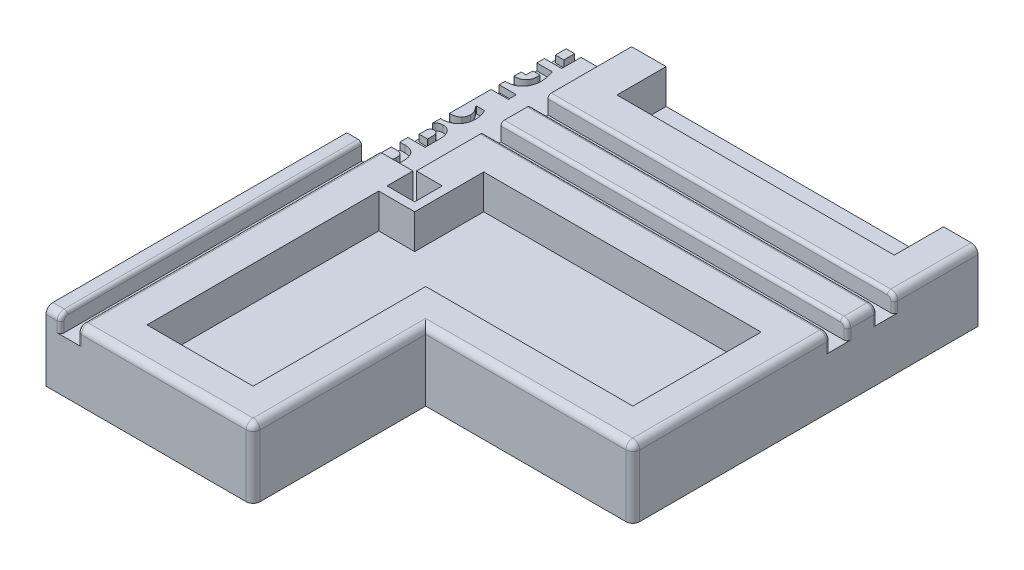
from build123d import *

# Parameters (mm, degrees)
SKETCH1_W                                  = 240
SKETCH1_H                                  = 200
BOSS_EXTRUDE1_DEPTH                        = 20
SKETCH7_W                                  = 120
SKETCH7_H                                  = 50
BOSS_EXTRUDE6_DEPTH                        = 20
FILLET1_R                                  = 2
SKETCH2_W                                  = 39.3
SKETCH2_H                                  = 125.7
CUT_EXTRUDE1_DEPTH                         = 10
CUT_EXTRUDE3_DEPTH                         = 5
MIRROR4_AT_THE_SECOND_PLANE_COPY_1_DEPTH   = 5
SKETCH11_W                                 = 104.748042719
SKETCH11_H                                 = 5
CUT_EXTRUDE4_DEPTH                         = 5
MIRROR6_AT_THE_SECOND_PLANE_COPY_1_SKETC_W = 104.748042719
MIRROR6_AT_THE_SECOND_PLANE_COPY_1_SKETC_H = 5
MIRROR6_AT_THE_SECOND_PLANE_COPY_1_DEPTH   = 5
SHELL1_START                               = 10
SHELL1_OUTLINE_W                           = 80.35
SHELL1_OUTLINE_H                           = 28.5
SHELL1_DEPTH                               = 10
FILLET3_R                                  = 1
SKETCH13_W                                 = 7.252545243
SKETCH13_H                                 = 2.335565418
SKETCH13_W_2                               = 1.720942939
SKETCH13_H_2                               = 2.581414408
CUT_EXTRUDE5_DEPTH                         = 2
CUT_EXTRUDE6_DEPTH                         = 10
MIRROR7_AT_THE_SECOND_PLANE_COPY_1_DEPTH   = 10
SKETCH15_W                                 = 252.845295914
SKETCH15_H                                 = 31.352816693
CUT_EXTRUDE7_DEPTH                         = 194.132079158
SKETCH16_W                                 = 170.828603052
SKETCH16_H                                 = 32.869888469
CUT_EXTRUDE8_DEPTH                         = 194.132079158


# Read off the part's stored shape, not the designer's step: Shell1
with BuildPart() as part:
    # Sketch1 → Boss-Extrude1 (new body)
    with BuildSketch(Plane(origin=(0, 0, 0), x_dir=(1, 0, 0), z_dir=(0, 1, 0))):
        Rectangle(SKETCH1_W, SKETCH1_H)
    extrude(amount=BOSS_EXTRUDE1_DEPTH)

    # Sketch7 → Boss-Extrude6 (add)
    with BuildSketch(Plane(origin=(0, 0, 0), x_dir=(1, 0, 0), z_dir=(0, 1, 0))):
        with Locations((0, 125)):
            Rectangle(SKETCH7_W, SKETCH7_H)
        with Locations((0, -125)):
            Rectangle(SKETCH7_W, SKETCH7_H)
    extrude(amount=BOSS_EXTRUDE6_DEPTH)

    # Fillet1
    fillet1_edges = [part.edges().sort_by_distance(p)[0] for p in [
        (-120, 20, 0),
        (90, 20, 100),
        (-90, 20, 100),
        (-60, 10, 150),
        (60, 10, 150),
        (-60, 20, 125),
        (0, 20, 150),
        (60, 20, 125),
        (-90, 20, -100),
        (60, 20, -125),
        (0, 20, -150),
        (60, 10, -150),
        (-60, 10, -150),
        (-60, 20, -125),
        (120, 20, 0),
        (120, 10, 100),
        (-120, 10, 100),
        (-120, 10, -100),
        (120, 10, -100),
        (90, 20, -100),
    ]]
    fillet(fillet1_edges, radius=FILLET1_R)

    # Sketch2 → Cut-Extrude1 (cut)
    with BuildSketch(Plane(origin=(0, 20, 0), x_dir=(1, 0, 0), z_dir=(0, 1, 0))):
        Rectangle(SKETCH2_W, SKETCH2_H)
    extrude(amount=-CUT_EXTRUDE1_DEPTH, mode=Mode.SUBTRACT)

    # Sketch10 → Cut-Extrude3 (cut)
    with BuildSketch(Plane(origin=(0, 20, 0), x_dir=(1, 0, 0), z_dir=(0, 1, 0))):
        Polygon((-9.25, -40.5), (-9.25, -33.162899401), (-4.25, -33.162899401), (-4.25, -40.5), (-4.25, -156.832928994), (-9.25, -156.832928994), align=None)
    cut_extrude3 = extrude(amount=-CUT_EXTRUDE3_DEPTH, mode=Mode.SUBTRACT)

    # Mirror4: Cut-Extrude3 across plane
    add(cut_extrude3.mirror(Plane(origin=(0, 0, 0), x_dir=(0, 0, 1), z_dir=(1, 0, 0))), mode=Mode.SUBTRACT)

    # Mirror4 at the second plane: Cut-Extrude3 across plane
    add(cut_extrude3.mirror(Plane.XY), mode=Mode.SUBTRACT)

    # Mirror4 at the second plane copy 1 sketc → Mirror4 at the second plane copy 1 (cut)
    with BuildSketch(Plane(origin=(0, 20, 0), x_dir=(-1, 0, 0), z_dir=(0, 1, 0))):
        Polygon((-9.25, -40.5), (-9.25, -33.162899401), (-4.25, -33.162899401), (-4.25, -40.5), (-4.25, -156.832928994), (-9.25, -156.832928994), align=None)
    extrude(amount=-MIRROR4_AT_THE_SECOND_PLANE_COPY_1_DEPTH, mode=Mode.SUBTRACT)

    # Sketch11 → Cut-Extrude4 (cut)
    with BuildSketch(Plane(origin=(0, 20, 0), x_dir=(1, 0, 0), z_dir=(0, 1, 0))):
        with Locations((-72.024021359, 26.75)):
            Rectangle(SKETCH11_W, SKETCH11_H)
        with Locations((-72.024021359, 40.35)):
            Rectangle(SKETCH11_W, SKETCH11_H)
    cut_extrude4 = extrude(amount=-CUT_EXTRUDE4_DEPTH, mode=Mode.SUBTRACT)

    # Mirror6: Cut-Extrude4 across plane
    add(cut_extrude4.mirror(Plane.XY), mode=Mode.SUBTRACT)

    # Mirror6 at the second plane: Cut-Extrude4 across plane
    add(cut_extrude4.mirror(Plane(origin=(0, 0, 0), x_dir=(0, 0, 1), z_dir=(1, 0, 0))), mode=Mode.SUBTRACT)

    # Mirror6 at the second plane copy 1 sketc → Mirror6 at the second plane copy 1 (cut)
    with BuildSketch(Plane(origin=(0, 20, 0), x_dir=(-1, 0, 0), z_dir=(0, 1, 0))):
        with Locations((-72.024021359, 26.75)):
            Rectangle(MIRROR6_AT_THE_SECOND_PLANE_COPY_1_SKETC_W, MIRROR6_AT_THE_SECOND_PLANE_COPY_1_SKETC_H)
        with Locations((-72.024021359, 40.35)):
            Rectangle(MIRROR6_AT_THE_SECOND_PLANE_COPY_1_SKETC_W, MIRROR6_AT_THE_SECOND_PLANE_COPY_1_SKETC_H)
    extrude(amount=-MIRROR6_AT_THE_SECOND_PLANE_COPY_1_DEPTH, mode=Mode.SUBTRACT)

    # Shell1 outline → Shell1 (cut)
    with BuildSketch(Plane(origin=(0, 0, 0), x_dir=(1, 0, 0), z_dir=(0, 1, 0)).offset(SHELL1_START)):
        Polygon((-29.65, 72.85), (-19.25, 72.85), (-19.25, 140), (-50, 140), (-50, 90), (-110, 90), (-110, 52.85), (-29.65, 52.85), align=None)
        Polygon((19.25, 72.85), (29.65, 72.85), (29.65, 52.85), (110, 52.85), (110, 90), (50, 90), (50, 140), (19.25, 140), align=None)
        Polygon((-110, -52.85), (-110, -90), (-50, -90), (-50, -140), (-19.25, -140), (-19.25, -72.85), (-29.65, -72.85), (-29.65, -52.85), align=None)
        with Locations((-69.825, 0)):
            Rectangle(SHELL1_OUTLINE_W, SHELL1_OUTLINE_H)
        Polygon((29.65, -72.85), (19.25, -72.85), (19.25, -140), (50, -140), (50, -90), (110, -90), (110, -52.85), (29.65, -52.85), align=None)
        with Locations((69.825, 0)):
            Rectangle(SHELL1_OUTLINE_W, SHELL1_OUTLINE_H)
    extrude(amount=SHELL1_DEPTH, mode=Mode.SUBTRACT)

    # Fillet3
    fillet3_edges = [part.edges().sort_by_distance(p)[0] for p in [
        (-4.25, 16.5, 150),
        (-4.25, 19.414213562, 149.414213562),
        (-9.25, 16.5, 150),
        (-9.25, 19.414213562, 149.414213562),
        (-4.25, 20, 105.425),
        (-9.25, 20, 105.425),
        (-9.25, 19.414213562, -149.414213562),
        (-9.25, 16.5, -150),
        (-9.25, 20, -105.425),
        (-4.25, 16.5, -150),
        (-4.25, 19.414213562, -149.414213562),
        (-4.25, 20, -105.425),
        (9.25, 16.5, 150),
        (9.25, 20, 105.425),
        (9.25, 19.414213562, 149.414213562),
        (4.25, 16.5, 150),
        (4.25, 19.414213562, 149.414213562),
        (4.25, 20, 105.425),
        (4.25, 16.5, -150),
        (4.25, 19.414213562, -149.414213562),
        (9.25, 19.414213562, -149.414213562),
        (9.25, 16.5, -150),
        (4.25, 20, -105.425),
        (9.25, 20, -105.425),
        (-120, 16.5, -24.25),
        (-120, 16.5, -29.25),
        (-119.414213562, 19.414213562, -24.25),
        (-119.414213562, 19.414213562, -29.25),
        (-68.825, 20, -24.25),
        (-68.825, 20, -29.25),
        (-120, 16.5, -37.85),
        (-120, 16.5, -42.85),
        (-68.825, 20, -37.85),
        (-68.825, 20, -42.85),
        (-119.414213562, 19.414213562, -37.85),
        (-119.414213562, 19.414213562, -42.85),
        (68.825, 20, -29.25),
        (119.414213562, 19.414213562, -29.25),
        (119.414213562, 19.414213562, -24.25),
        (68.825, 20, -24.25),
        (120, 16.5, -29.25),
        (120, 16.5, -24.25),
        (68.825, 20, -42.85),
        (119.414213562, 19.414213562, -42.85),
        (119.414213562, 19.414213562, -37.85),
        (68.825, 20, -37.85),
        (120, 16.5, -42.85),
        (120, 16.5, -37.85),
        (-120, 16.5, 29.25),
        (-120, 16.5, 24.25),
        (-68.825, 20, 29.25),
        (-119.414213562, 19.414213562, 29.25),
        (-119.414213562, 19.414213562, 24.25),
        (-68.825, 20, 24.25),
        (-120, 16.5, 42.85),
        (-120, 16.5, 37.85),
        (-68.825, 20, 42.85),
        (-119.414213562, 19.414213562, 42.85),
        (-119.414213562, 19.414213562, 37.85),
        (-68.825, 20, 37.85),
        (120, 16.5, 24.25),
        (120, 16.5, 29.25),
        (119.414213562, 19.414213562, 24.25),
        (119.414213562, 19.414213562, 29.25),
        (68.825, 20, 24.25),
        (68.825, 20, 29.25),
        (120, 16.5, 37.85),
        (120, 16.5, 42.85),
        (68.825, 20, 37.85),
        (68.825, 20, 42.85),
        (119.414213562, 19.414213562, 37.85),
        (119.414213562, 19.414213562, 42.85),
    ]]
    fillet(fillet3_edges, radius=FILLET3_R)

    # Sketch13 → Cut-Extrude5 (cut)
    # profile 1 of 12: a face of its own
    with BuildSketch(Plane(origin=(0, 10, 0), x_dir=(1, 0, 0), z_dir=(0, 1, 0))):
        Polygon((2.787359078, 56.729654742), (2.787359078, 55.37748529), (5, 55.37748529), (5, 53.041919872), (2.787359078, 53.041919872), (2.787359078, 48.247864542), (0.880108701, 48.247864542), (-4.711035156, 52.886343558), (-4.711035156, 55.37748529), (0.943491644, 55.37748529), (0.943491644, 56.729654742), align=None)
        Polygon((0.943491644, 53.041919872), (-2.596349692, 53.041919872), (0.943491644, 50.110938929), align=None, mode=Mode.SUBTRACT)
    # profile 2 of 12: a face of its own
    with BuildSketch(Plane(origin=(0, 10, 0), x_dir=(1, 0, 0), z_dir=(0, 1, 0))):
        with BuildLine():
            Line((5, 47.141544081), (5, 39.520225351))
            Line((5, 39.520225351), (3.409664338, 39.520225351))
            add(Edge.make_bspline(
                [(3.409664338, 39.520225351), (3.190599668, 39.81675512), (2.747057383, 40.417141716), (2.167094132, 41.14339637), (1.704390868, 41.703253096), (1.381972101, 42.083056551), (1.083256561, 42.417759603), (0.887687077, 42.622007507), (0.79559811, 42.718182933)],
                knots=[0, 0, 0, 0, 1.605452287, 3.25057426, 4.046675402, 4.768563423, 5.420146126, 6, 6, 6, 6], degree=3))
            add(Edge.make_bspline(
                [(0.79559811, 42.718182933), (0.732570292, 42.782561984), (0.609352585, 42.908421315), (0.423765416, 43.085974145), (0.244476812, 43.249198615), (0.074088064, 43.400664381), (-0.092796487, 43.534082219), (-0.252790737, 43.654099684), (-0.406497488, 43.759962438), (-0.599845109, 43.881290453), (-0.837875375, 44.00401532), (-1.125540586, 44.112139625), (-1.412736444, 44.178491494), (-1.604945873, 44.187117789), (-1.699385013, 44.191356186)],
                knots=[0, 0, 0, 0, 1.090093853, 2.131104457, 3.107135244, 4.023908394, 4.888948297, 5.691514549, 6.4435893, 7.146498757, 8.452673016, 9.675803408, 10.85804184, 12, 12, 12, 12], degree=3))
            add(Edge.make_bspline(
                [(-1.699385013, 44.191356186), (-1.754483363, 44.189605987), (-1.861179083, 44.186216799), (-2.017224671, 44.167846758), (-2.162681909, 44.132103765), (-2.300488192, 44.087839319), (-2.42643972, 44.024206924), (-2.544199113, 43.950411254), (-2.650531499, 43.859818439), (-2.749307162, 43.758726543), (-2.834556733, 43.642742478), (-2.911599654, 43.517157005), (-2.971430142, 43.377241787), (-3.024398474, 43.226819474), (-3.063653395, 43.063897589), (-3.092633036, 42.889340485), (-3.109905835, 42.703165878), (-3.111960528, 42.574807759), (-3.113016713, 42.508827152)],
                knots=[0, 0, 0, 0, 1.058578686, 2.049894692, 3.010224385, 3.931750511, 4.822578239, 5.71281177, 6.594427321, 7.498813824, 8.420995957, 9.353043897, 10.321837571, 11.3367408, 12.413304787, 13.535187771, 14.732999458, 16, 16, 16, 16], degree=3))
            add(Edge.make_bspline(
                [(-3.113016713, 42.508827152), (-3.110052719, 42.405568465), (-3.104041103, 42.196137688), (-3.053985994, 41.878413923), (-2.980602684, 41.552282773), (-2.873221808, 41.222921491), (-2.74714341, 40.895094854), (-2.596251992, 40.578640505), (-2.438170844, 40.269132893), (-2.314289691, 40.074405983), (-2.252545243, 39.977350819)],
                knots=[0, 0, 0, 0, 0.914703558, 1.855215137, 2.844920106, 3.875005138, 4.922433174, 5.955639304, 6.981056277, 8, 8, 8, 8], degree=3))
            Line((-2.252545243, 39.977350819), (-2.252545243, 39.766074342))
            Line((-2.252545243, 39.766074342), (-4.363389317, 39.766074342))
            add(Edge.make_bspline(
                [(-4.363389317, 39.766074342), (-4.396975153, 39.85152697), (-4.470639347, 40.038951181), (-4.568658946, 40.352153969), (-4.66491051, 40.720660415), (-4.763825821, 41.132864511), (-4.849735205, 41.573321973), (-4.910075419, 42.024211578), (-4.95119256, 42.474770211), (-4.954991729, 42.775713815), (-4.956884148, 42.92561802)],
                knots=[0, 0, 0, 0, 0.681686624, 1.495150967, 2.435076171, 3.509887788, 4.642826517, 5.765734475, 6.887081194, 8, 8, 8, 8], degree=3))
            add(Edge.make_bspline(
                [(-4.956884148, 42.92561802), (-4.954912362, 43.072306092), (-4.951074185, 43.357841566), (-4.914531776, 43.772464491), (-4.853049644, 44.160650299), (-4.769612134, 44.521836328), (-4.662431161, 44.856562797), (-4.529987596, 45.163893905), (-4.371768891, 45.443672956), (-4.191325, 45.69718541), (-3.986517109, 45.920499957), (-3.762299213, 46.116633841), (-3.516918106, 46.283180062), (-3.250583577, 46.417510178), (-2.964907945, 46.521931142), (-2.659732708, 46.596780352), (-2.333869778, 46.641015432), (-2.109911454, 46.646854566), (-1.995172081, 46.649846099)],
                knots=[0, 0, 0, 0, 1.302669921, 2.535710425, 3.693104205, 4.791067539, 5.825099944, 6.810730835, 7.758000335, 8.67487823, 9.568447078, 10.443087854, 11.315285082, 12.19521531, 13.085757283, 14.011200708, 14.981089066, 16, 16, 16, 16], degree=3))
            add(Edge.make_bspline(
                [(-1.995172081, 46.649846099), (-1.918295051, 46.648245135), (-1.764899121, 46.645050664), (-1.536586701, 46.623146341), (-1.311198259, 46.589276583), (-1.089189633, 46.538876948), (-0.870129482, 46.472993238), (-0.653296175, 46.39436831), (-0.439122967, 46.302496277), (-0.229338943, 46.193054838), (-0.018163961, 46.072147599), (0.191952814, 45.932794317), (0.405837655, 45.781094454), (0.620958688, 45.614342324), (0.835471411, 45.430057751), (1.055741697, 45.23549192), (1.273520634, 45.021368665), (1.417594688, 44.872241147), (1.490889788, 44.796375188)],
                knots=[0, 0, 0, 0, 0.907170522, 1.810115022, 2.704515666, 3.595334857, 4.494160497, 5.402400165, 6.316123003, 7.242010315, 8.19323076, 9.186549597, 10.215937183, 11.28746875, 12.397107329, 13.552885457, 14.755074217, 16, 16, 16, 16], degree=3))
            add(Edge.make_bspline(
                [(1.490889788, 44.796375188), (1.669671754, 44.600991906), (2.021428479, 44.216571794), (2.422503942, 43.720261203), (2.710127438, 43.347225494), (2.892573427, 43.11547907), (3.035611297, 42.923413887), (3.11966375, 42.809753418), (3.156132565, 42.760438229)],
                knots=[0, 0, 0, 0, 1.811045763, 3.563265038, 4.362127914, 5.033096026, 5.580478129, 6, 6, 6, 6], degree=3))
            Line((3.156132565, 42.760438229), (3.156132565, 47.141544081))
            Line((3.156132565, 47.141544081), (5, 47.141544081))
        make_face()
    # profile 3 of 12: a face of its own
    with BuildSketch(Plane(origin=(0, 10, 0), x_dir=(1, 0, 0), z_dir=(0, 1, 0))):
        with BuildLine():
            add(Edge.make_bspline(
                [(0.138720336, 37.553433421), (0.339837036, 37.551198694), (0.731017162, 37.546852061), (1.301575539, 37.503210957), (1.839727263, 37.435290008), (2.344336806, 37.340402007), (2.812295891, 37.218717557), (3.235819492, 37.059739443), (3.620265586, 36.877229499), (3.845547684, 36.720963882), (3.955141787, 36.64494457)],
                knots=[0, 0, 0, 0, 1.210994604, 2.355433537, 3.443919748, 4.476135166, 5.446013627, 6.351277171, 7.197937607, 8, 8, 8, 8], degree=3))
            add(Edge.make_bspline(
                [(3.955141787, 36.64494457), (4.057367971, 36.5617232), (4.260610648, 36.396265258), (4.524020765, 36.101981434), (4.745368417, 35.772676286), (4.897303004, 35.472877401), (4.999247268, 35.217133399), (5.063592063, 35.011802969), (5.122267484, 34.796985151), (5.167723638, 34.570405454), (5.201934481, 34.333084121), (5.226664862, 34.085073274), (5.242295446, 33.825562266), (5.244648027, 33.648682389), (5.245848991, 33.558387312)],
                knots=[0, 0, 0, 0, 1.363120718, 2.710110989, 4.070537742, 5.460816644, 6.180869889, 6.918733188, 7.687278466, 8.485437086, 9.309407483, 10.168795045, 11.065191617, 12, 12, 12, 12], degree=3))
            add(Edge.make_bspline(
                [(5.245848991, 33.558387312), (5.241905689, 33.384062955), (5.234297073, 33.047703496), (5.173081199, 32.562988904), (5.069699732, 32.118069919), (4.926806373, 31.711596248), (4.739854178, 31.34454147), (4.516760058, 31.013155063), (4.251279595, 30.717979546), (4.045332533, 30.554230832), (3.94169692, 30.471830054)],
                knots=[0, 0, 0, 0, 1.200851745, 2.317047666, 3.359233085, 4.342911255, 5.278031965, 6.189548012, 7.088953741, 8, 8, 8, 8], degree=3))
            add(Edge.make_bspline(
                [(3.94169692, 30.471830054), (3.829424185, 30.3947628), (3.600170882, 30.2373967), (3.214838014, 30.049115343), (2.792701976, 29.89168932), (2.331256748, 29.768085058), (1.834031119, 29.675388633), (1.301418942, 29.61187027), (0.734794995, 29.570336966), (0.344952566, 29.565716964), (0.144482422, 29.563341204)],
                knots=[0, 0, 0, 0, 0.822750793, 1.680001256, 2.58557045, 3.544707477, 4.565467581, 5.642347189, 6.787615291, 8, 8, 8, 8], degree=3))
            add(Edge.make_bspline(
                [(0.144482422, 29.563341204), (-0.061754837, 29.565532126), (-0.459970452, 29.569762495), (-1.036345286, 29.613069323), (-1.570746564, 29.680774054), (-2.065452333, 29.775711056), (-2.521358164, 29.900947264), (-2.938473361, 30.06222162), (-3.323134476, 30.249194002), (-3.55325365, 30.406272972), (-3.666176943, 30.483354226)],
                knots=[0, 0, 0, 0, 1.242237956, 2.39858964, 3.479780431, 4.485821505, 5.430991799, 6.32348679, 7.177307181, 8, 8, 8, 8], degree=3))
            add(Edge.make_bspline(
                [(-3.666176943, 30.483354226), (-3.769193286, 30.566416838), (-3.974708441, 30.732124775), (-4.238285133, 31.029639616), (-4.461065672, 31.362253167), (-4.645070962, 31.729678272), (-4.784115122, 32.135791847), (-4.885860052, 32.577168574), (-4.944671996, 33.056148657), (-4.952723667, 33.387282789), (-4.956884148, 33.558387312)],
                knots=[0, 0, 0, 0, 0.915406887, 1.826214983, 2.74012738, 3.682217607, 4.664024873, 5.706462388, 6.814877053, 8, 8, 8, 8], degree=3))
            add(Edge.make_bspline(
                [(-4.956884148, 33.558387312), (-4.955682618, 33.64868302), (-4.953320425, 33.826203271), (-4.937576888, 34.086978277), (-4.913381513, 34.337057391), (-4.877300412, 34.575699285), (-4.828262853, 34.80214551), (-4.773499009, 35.018778584), (-4.706561244, 35.224310597), (-4.601886899, 35.480626422), (-4.447267393, 35.781827029), (-4.217150947, 36.109134402), (-3.948246131, 36.405401156), (-3.739143401, 36.569659884), (-3.633525124, 36.652627351)],
                knots=[0, 0, 0, 0, 0.927772364, 1.823989051, 2.683453821, 3.508702832, 4.302191287, 5.063276402, 5.803871599, 6.520953588, 7.906777029, 9.27188215, 10.622021304, 12, 12, 12, 12], degree=3))
            add(Edge.make_bspline(
                [(-3.633525124, 36.652627351), (-3.521300204, 36.729189524), (-3.292789343, 36.885084383), (-2.908970475, 37.068290297), (-2.492360426, 37.225455121), (-2.036263275, 37.346342452), (-1.54437137, 37.439204828), (-1.015826808, 37.505677425), (-0.450933502, 37.546286922), (-0.061742996, 37.551003841), (0.138720336, 37.553433421)],
                knots=[0, 0, 0, 0, 0.826423845, 1.682753026, 2.582377666, 3.535958882, 4.552416628, 5.629628825, 6.779074777, 8, 8, 8, 8], degree=3))
        make_face()
        with BuildLine():
            add(Edge.make_bspline(
                [(0.138720336, 35.094943508), (-0.002794049, 35.093990238), (-0.275052116, 35.092156251), (-0.667644343, 35.074004214), (-1.028464631, 35.048543297), (-1.357952356, 35.010483072), (-1.656192237, 34.961169576), (-1.923473104, 34.900935006), (-2.158488294, 34.828227196), (-2.363936988, 34.745989678), (-2.54162794, 34.64913888), (-2.69467252, 34.537908006), (-2.823572221, 34.410664927), (-2.931286275, 34.270097317), (-3.011274034, 34.111739825), (-3.072443859, 33.941187009), (-3.106785969, 33.754382189), (-3.110895684, 33.625106618), (-3.113016713, 33.558387312)],
                knots=[0, 0, 0, 0, 1.684598718, 3.240982106, 4.677870026, 5.990101975, 7.188004416, 8.275163324, 9.249099904, 10.113910365, 10.905306099, 11.652292794, 12.358339015, 13.054983843, 13.750418457, 14.461547751, 15.206002611, 16, 16, 16, 16], degree=3))
            add(Edge.make_bspline(
                [(-3.113016713, 33.558387312), (-3.110895681, 33.491668012), (-3.106785962, 33.362392453), (-3.072443884, 33.175587552), (-3.011273943, 33.005035023), (-2.931286606, 32.84667649), (-2.823570979, 32.706112772), (-2.694677343, 32.578854684), (-2.541608299, 32.467684345), (-2.363496496, 32.37029911), (-2.157013742, 32.289020864), (-1.921590867, 32.215742751), (-1.654258135, 32.155647372), (-1.355414385, 32.106122047), (-1.024612933, 32.068276855), (-0.661244964, 32.04269777), (-0.266085327, 32.024665897), (0.008090715, 32.022799039), (0.150244508, 32.021831116)],
                knots=[0, 0, 0, 0, 0.791766581, 1.534129826, 2.243261137, 2.936741863, 3.631429404, 4.335491923, 5.08037989, 5.869552125, 6.738971147, 7.710171362, 8.794275798, 9.988812621, 11.304907075, 12.745337551, 14.312534512, 16, 16, 16, 16], degree=3))
            add(Edge.make_bspline(
                [(0.150244508, 32.021831116), (0.289201434, 32.022765136), (0.556986265, 32.024565091), (0.943773412, 32.043063349), (1.30096878, 32.067483158), (1.627502144, 32.109075315), (1.924420257, 32.156514098), (2.190195476, 32.220950105), (2.427221865, 32.292197549), (2.635687527, 32.376524358), (2.816464841, 32.475577579), (2.974492505, 32.586386469), (3.106149375, 32.714997304), (3.215613674, 32.855867424), (3.298888327, 33.012083539), (3.358752163, 33.181622444), (3.396338685, 33.365314373), (3.400067537, 33.492898418), (3.401981557, 33.558387312)],
                knots=[0, 0, 0, 0, 1.658832269, 3.196746878, 4.622488866, 5.931787449, 7.125569234, 8.210133994, 9.194149195, 10.078471196, 10.889203548, 11.650697572, 12.375032472, 13.07829054, 13.77251817, 14.478471121, 15.218999177, 16, 16, 16, 16], degree=3))
            add(Edge.make_bspline(
                [(3.401981557, 33.558387312), (3.400068186, 33.623876875), (3.3963406, 33.751462223), (3.358745104, 33.935144911), (3.298913291, 34.10471679), (3.215521541, 34.260812329), (3.106775331, 34.40178813), (2.97377315, 34.528364287), (2.816557237, 34.639341559), (2.635707586, 34.738476019), (2.42683161, 34.821967534), (2.190341985, 34.897522561), (1.921851262, 34.956560743), (1.624132619, 35.009519497), (1.295502071, 35.045529443), (0.936895825, 35.074962985), (0.547988509, 35.091838226), (0.278306115, 35.093884415), (0.138720336, 35.094943508)],
                knots=[0, 0, 0, 0, 0.778971247, 1.517574904, 2.221693305, 2.914116855, 3.615547377, 4.332711038, 5.092226179, 5.900851692, 6.782875619, 7.766611013, 8.854037796, 10.053520173, 11.366075456, 12.788704916, 14.337855446, 16, 16, 16, 16], degree=3))
        make_face(mode=Mode.SUBTRACT)
    # profile 4 of 12: a face of its own
    with BuildSketch(Plane(origin=(0, 10, 0), x_dir=(1, 0, 0), z_dir=(0, 1, 0))):
        with BuildLine():
            Line((5, 28.211171751), (5, 20.589853021))
            Line((5, 20.589853021), (3.409664338, 20.589853021))
            add(Edge.make_bspline(
                [(3.409664338, 20.589853021), (3.190599668, 20.88638279), (2.747057383, 21.486769386), (2.167094132, 22.21302404), (1.704390868, 22.772880767), (1.381972101, 23.152684221), (1.083256561, 23.487387273), (0.887687077, 23.691635177), (0.79559811, 23.787810603)],
                knots=[0, 0, 0, 0, 1.605452287, 3.25057426, 4.046675402, 4.768563423, 5.420146126, 6, 6, 6, 6], degree=3))
            add(Edge.make_bspline(
                [(0.79559811, 23.787810603), (0.732570292, 23.852189654), (0.609352585, 23.978048985), (0.423765416, 24.155601815), (0.244476812, 24.318826285), (0.074088064, 24.470292051), (-0.092796487, 24.60370989), (-0.252790737, 24.723727355), (-0.406497488, 24.829590108), (-0.599845109, 24.950918123), (-0.837875375, 25.07364299), (-1.125540586, 25.181767295), (-1.412736444, 25.248119164), (-1.604945873, 25.256745459), (-1.699385013, 25.260983856)],
                knots=[0, 0, 0, 0, 1.090093853, 2.131104457, 3.107135244, 4.023908394, 4.888948297, 5.691514549, 6.4435893, 7.146498757, 8.452673016, 9.675803408, 10.85804184, 12, 12, 12, 12], degree=3))
            add(Edge.make_bspline(
                [(-1.699385013, 25.260983856), (-1.754483363, 25.259233658), (-1.861179083, 25.25584447), (-2.017224671, 25.237474428), (-2.162681909, 25.201731435), (-2.300488192, 25.157466989), (-2.42643972, 25.093834595), (-2.544199113, 25.020038924), (-2.650531499, 24.929446109), (-2.749307162, 24.828354213), (-2.834556733, 24.712370148), (-2.911599654, 24.586784675), (-2.971430142, 24.446869457), (-3.024398474, 24.296447144), (-3.063653395, 24.133525259), (-3.092633036, 23.958968155), (-3.109905835, 23.772793548), (-3.111960528, 23.644435429), (-3.113016713, 23.578454822)],
                knots=[0, 0, 0, 0, 1.058578686, 2.049894692, 3.010224385, 3.931750511, 4.822578239, 5.71281177, 6.594427321, 7.498813824, 8.420995957, 9.353043897, 10.321837571, 11.3367408, 12.413304787, 13.535187771, 14.732999458, 16, 16, 16, 16], degree=3))
            add(Edge.make_bspline(
                [(-3.113016713, 23.578454822), (-3.110052719, 23.475196136), (-3.104041103, 23.265765358), (-3.053985994, 22.948041593), (-2.980602684, 22.621910443), (-2.873221808, 22.292549161), (-2.74714341, 21.964722525), (-2.596251992, 21.648268175), (-2.438170844, 21.338760563), (-2.314289691, 21.144033653), (-2.252545243, 21.046978489)],
                knots=[0, 0, 0, 0, 0.914703558, 1.855215137, 2.844920106, 3.875005138, 4.922433174, 5.955639304, 6.981056277, 8, 8, 8, 8], degree=3))
            Line((-2.252545243, 21.046978489), (-2.252545243, 20.835702012))
            Line((-2.252545243, 20.835702012), (-4.363389317, 20.835702012))
            add(Edge.make_bspline(
                [(-4.363389317, 20.835702012), (-4.396975153, 20.92115464), (-4.470639347, 21.108578851), (-4.568658946, 21.421781639), (-4.66491051, 21.790288086), (-4.763825821, 22.202492181), (-4.849735205, 22.642949643), (-4.910075419, 23.093839248), (-4.95119256, 23.544397881), (-4.954991729, 23.845341485), (-4.956884148, 23.99524569)],
                knots=[0, 0, 0, 0, 0.681686624, 1.495150967, 2.435076171, 3.509887788, 4.642826517, 5.765734475, 6.887081194, 8, 8, 8, 8], degree=3))
            add(Edge.make_bspline(
                [(-4.956884148, 23.99524569), (-4.954912362, 24.141933762), (-4.951074185, 24.427469237), (-4.914531776, 24.842092162), (-4.853049644, 25.230277969), (-4.769612134, 25.591463998), (-4.662431161, 25.926190468), (-4.529987596, 26.233521576), (-4.371768891, 26.513300626), (-4.191325, 26.76681308), (-3.986517109, 26.990127627), (-3.762299213, 27.186261512), (-3.516918106, 27.352807733), (-3.250583577, 27.487137848), (-2.964907945, 27.591558812), (-2.659732708, 27.666408023), (-2.333869778, 27.710643103), (-2.109911454, 27.716482236), (-1.995172081, 27.719473769)],
                knots=[0, 0, 0, 0, 1.302669921, 2.535710425, 3.693104205, 4.791067539, 5.825099944, 6.810730835, 7.758000335, 8.67487823, 9.568447078, 10.443087854, 11.315285082, 12.19521531, 13.085757283, 14.011200708, 14.981089066, 16, 16, 16, 16], degree=3))
            add(Edge.make_bspline(
                [(-1.995172081, 27.719473769), (-1.918295051, 27.717872805), (-1.764899121, 27.714678334), (-1.536586701, 27.692774011), (-1.311198259, 27.658904253), (-1.089189633, 27.608504619), (-0.870129482, 27.542620908), (-0.653296175, 27.46399598), (-0.439122967, 27.372123947), (-0.229338943, 27.262682508), (-0.018163961, 27.141775269), (0.191952814, 27.002421987), (0.405837655, 26.850722124), (0.620958688, 26.683969994), (0.835471411, 26.499685422), (1.055741697, 26.30511959), (1.273520634, 26.090996335), (1.417594688, 25.941868817), (1.490889788, 25.866002858)],
                knots=[0, 0, 0, 0, 0.907170522, 1.810115022, 2.704515666, 3.595334857, 4.494160497, 5.402400165, 6.316123003, 7.242010315, 8.19323076, 9.186549597, 10.215937183, 11.28746875, 12.397107329, 13.552885457, 14.755074217, 16, 16, 16, 16], degree=3))
            add(Edge.make_bspline(
                [(1.490889788, 25.866002858), (1.669671754, 25.670619576), (2.021428479, 25.286199464), (2.422503942, 24.789888873), (2.710127438, 24.416853164), (2.892573427, 24.18510674), (3.035611297, 23.993041557), (3.11966375, 23.879381088), (3.156132565, 23.830065899)],
                knots=[0, 0, 0, 0, 1.811045763, 3.563265038, 4.362127914, 5.033096026, 5.580478129, 6, 6, 6, 6], degree=3))
            Line((3.156132565, 23.830065899), (3.156132565, 28.211171751))
            Line((3.156132565, 28.211171751), (5, 28.211171751))
        make_face()
    # profile 5 of 12: a face of its own
    with BuildSketch(Plane(origin=(0, 10, 0), x_dir=(1, 0, 0), z_dir=(0, 1, 0))):
        Polygon((5, 13.583156769), (5, 11.124666856), (-1.524601746, 11.124666856), (2.664434583, 9.338420279), (2.664434583, 7.625160121), (-1.524601746, 5.838913543), (5, 5.838913543), (5, 3.503348126), (-4.711035156, 3.503348126), (-4.711035156, 6.382470298), (0.125275469, 8.549014533), (-4.711035156, 10.709796683), (-4.711035156, 13.583156769), align=None)
    # profile 6 of 12: a face of its own
    with BuildSketch(Plane(origin=(0, 10, 0), x_dir=(1, 0, 0), z_dir=(0, 1, 0))):
        Polygon((5, 1.4136317), (5, -5.593064552), (-4.711035156, -5.593064552), (-4.711035156, 1.4136317), (-2.867167722, 1.4136317), (-2.867167722, -3.134574639), (-1.146224782, -3.134574639), (-1.146224782, 1.044858213), (0.697642652, 1.044858213), (0.697642652, -3.134574639), (3.156132565, -3.134574639), (3.156132565, 1.4136317), align=None)
    # profile 7 of 12: a face of its own
    with BuildSketch(Plane(origin=(0, 10, 0), x_dir=(1, 0, 0), z_dir=(0, 1, 0))):
        with BuildLine():
            add(Edge.make_bspline(
                [(4.475650198, -7.805705474), (4.519354839, -7.923859504), (4.612512661, -8.17570855), (4.743574124, -8.583890089), (4.866671289, -9.047274178), (4.996208031, -9.552124696), (5.106381276, -10.084227717), (5.187397941, -10.625264318), (5.237323662, -11.165972628), (5.243010567, -11.526628491), (5.245848991, -11.706637515)],
                knots=[0, 0, 0, 0, 0.756485239, 1.612472169, 2.573171414, 3.635272123, 4.742182008, 5.834553763, 6.919191659, 8, 8, 8, 8], degree=3))
            add(Edge.make_bspline(
                [(5.245848991, -11.706637515), (5.241962961, -11.909112321), (5.234392087, -12.303579456), (5.17063924, -12.878829296), (5.062937634, -13.419584917), (4.916847086, -13.928231287), (4.72267015, -14.400885619), (4.491042888, -14.842463027), (4.211679163, -15.247896521), (3.893490591, -15.618759753), (3.53655883, -15.9505899), (3.145758166, -16.239699566), (2.72146993, -16.48347792), (2.264846611, -16.681095463), (1.776896349, -16.838089964), (1.255150105, -16.944841813), (0.702111097, -17.014888699), (0.322052776, -17.021601157), (0.127196165, -17.025042647)],
                knots=[0, 0, 0, 0, 1.160705024, 2.261318311, 3.313123859, 4.319096107, 5.290496718, 6.238021168, 7.172737693, 8.107230733, 9.03451477, 9.961071912, 10.888559376, 11.833805606, 12.808979065, 13.821966168, 14.883317984, 16, 16, 16, 16], degree=3))
            add(Edge.make_bspline(
                [(0.127196165, -17.025042647), (-0.058682323, -17.02067815), (-0.422730133, -17.012130168), (-0.955049114, -16.943336637), (-1.460067022, -16.832867692), (-1.937766829, -16.677677821), (-2.386372436, -16.473696921), (-2.808700267, -16.227656485), (-3.203463564, -15.935836699), (-3.565000576, -15.598836264), (-3.895700628, -15.226075236), (-4.177610929, -14.810267907), (-4.422741814, -14.363406013), (-4.616779655, -13.8775432), (-4.772219277, -13.359136807), (-4.876169413, -12.804694831), (-4.946971316, -12.216810998), (-4.953520434, -11.812500101), (-4.956884148, -11.604840667)],
                knots=[0, 0, 0, 0, 1.061573339, 2.079118747, 3.060574866, 4.011305467, 4.942696719, 5.870461571, 6.798745348, 7.740825567, 8.68941507, 9.638984161, 10.604583371, 11.595514188, 12.621960228, 13.691449096, 14.814297672, 16, 16, 16, 16], degree=3))
            add(Edge.make_bspline(
                [(-4.956884148, -11.604840667), (-4.954318925, -11.445386322), (-4.949235323, -11.129389392), (-4.919388643, -10.661251886), (-4.863951384, -10.205248288), (-4.792453594, -9.753475749), (-4.684946461, -9.294730481), (-4.534849919, -8.818874824), (-4.346707534, -8.316660693), (-4.193287983, -7.980233106), (-4.113698935, -7.805705474)],
                knots=[0, 0, 0, 0, 0.974479143, 1.931163549, 2.86485946, 3.780778834, 4.725046501, 5.741022375, 6.828116267, 8, 8, 8, 8], degree=3))
            Line((-4.113698935, -7.805705474), (-1.883771756, -7.805705474))
            Line((-1.883771756, -7.805705474), (-1.883771756, -8.091889065))
            add(Edge.make_bspline(
                [(-1.883771756, -8.091889065), (-1.906716104, -8.126531064), (-1.957410079, -8.203070203), (-2.043059993, -8.326945943), (-2.137489474, -8.476111594), (-2.284548962, -8.694884397), (-2.45960062, -8.978067997), (-2.581693909, -9.213466955), (-2.640525683, -9.326896107)],
                knots=[0, 0, 0, 0, 0.515980687, 1.140024195, 1.869947604, 2.707876564, 4.413660046, 6, 6, 6, 6], degree=3))
            add(Edge.make_bspline(
                [(-2.640525683, -9.326896107), (-2.672756546, -9.393740863), (-2.73882048, -9.530753251), (-2.823836627, -9.749019276), (-2.905177649, -9.981830174), (-2.978097, -10.22950925), (-3.037034138, -10.489919732), (-3.082413494, -10.759686706), (-3.106467195, -11.03779789), (-3.110821171, -11.225783758), (-3.113016713, -11.320577771)],
                knots=[0, 0, 0, 0, 0.861448091, 1.765719082, 2.717953576, 3.724891765, 4.761927522, 5.816719679, 6.89905606, 8, 8, 8, 8], degree=3))
            add(Edge.make_bspline(
                [(-3.113016713, -11.320577771), (-3.110164997, -11.430782772), (-3.104578279, -11.646682304), (-3.068710383, -11.963218824), (-3.004292393, -12.263584213), (-2.918860854, -12.549882667), (-2.805175217, -12.820581595), (-2.662381265, -13.075068024), (-2.499039638, -13.320076357), (-2.36711736, -13.466852812), (-2.300562624, -13.540901474)],
                knots=[0, 0, 0, 0, 1.091217493, 2.137773647, 3.148547478, 4.129133693, 5.092188092, 6.048375109, 7.015406034, 8, 8, 8, 8], degree=3))
            add(Edge.make_bspline(
                [(-2.300562624, -13.540901474), (-2.231129169, -13.608753509), (-2.090799964, -13.745886571), (-1.846186727, -13.91943259), (-1.579009792, -14.07619004), (-1.283734201, -14.208811415), (-0.962723927, -14.314570988), (-0.616833633, -14.387928819), (-0.248028071, -14.435679856), (0.006035391, -14.440927383), (0.136799641, -14.443628239)],
                knots=[0, 0, 0, 0, 0.871242595, 1.760833901, 2.686460846, 3.652134751, 4.663748384, 5.717797841, 6.825370436, 8, 8, 8, 8], degree=3))
            add(Edge.make_bspline(
                [(0.136799641, -14.443628239), (0.270078203, -14.441217619), (0.528956778, -14.436535262), (0.904701948, -14.395518364), (1.257245759, -14.329288021), (1.585144219, -14.233472949), (1.889752999, -14.11198958), (2.170660406, -13.964565335), (2.424839249, -13.78559248), (2.657673098, -13.584235453), (2.862193118, -13.352834409), (3.041867765, -13.096983341), (3.191530728, -12.813783401), (3.315763592, -12.506455713), (3.407777269, -12.172177215), (3.477785429, -11.813452581), (3.51753353, -11.428392977), (3.522401475, -11.163169785), (3.524906052, -11.026711399)],
                knots=[0, 0, 0, 0, 1.162877018, 2.258757441, 3.29433279, 4.289818334, 5.235063129, 6.152415668, 7.05144509, 7.94239879, 8.832861761, 9.739671241, 10.664582224, 11.622279774, 12.626959197, 13.685538709, 14.809200461, 16, 16, 16, 16], degree=3))
            add(Edge.make_bspline(
                [(3.524906052, -11.026711399), (3.524545414, -10.976125561), (3.523787414, -10.869802624), (3.51698298, -10.707868976), (3.511542352, -10.544994826), (3.50110347, -10.438303115), (3.496095624, -10.387119882)],
                knots=[0, 0, 0, 0, 0.947728294, 1.991965744, 3.036685378, 4, 4, 4, 4], degree=3))
            Line((3.496095624, -10.387119882), (1.435189626, -10.387119882))
            Line((1.435189626, -10.387119882), (1.435189626, -12.353911813))
            Line((1.435189626, -12.353911813), (-0.408677809, -12.353911813))
            Line((-0.408677809, -12.353911813), (-0.408677809, -7.805705474))
            Line((-0.408677809, -7.805705474), (4.475650198, -7.805705474))
        make_face()
    # profile 8 of 12: a face of its own
    with BuildSketch(Plane(origin=(0, 10, 0), x_dir=(1, 0, 0), z_dir=(0, 1, 0))):
        with Locations((1.373727378, -19.913768295)):
            Rectangle(SKETCH13_W, SKETCH13_H)
    # profile 9 of 12: a face of its own
    with BuildSketch(Plane(origin=(0, 10, 0), x_dir=(1, 0, 0), z_dir=(0, 1, 0))):
        with Locations((-4.219337174, -19.913768295)):
            Rectangle(SKETCH13_W_2, SKETCH13_H_2)
    # profile 10 of 12: a face of its own
    with BuildSketch(Plane(origin=(0, 10, 0), x_dir=(1, 0, 0), z_dir=(0, 1, 0))):
        with BuildLine():
            add(Edge.make_bspline(
                [(5.245848991, -30.773379208), (5.241556228, -30.949600555), (5.233101922, -31.296656552), (5.17328717, -31.807137753), (5.071443943, -32.296870987), (4.929457053, -32.76358831), (4.750483589, -33.205121013), (4.527408056, -33.614715808), (4.267338932, -33.994815031), (4.061606502, -34.220067298), (3.958983177, -34.332427496)],
                knots=[0, 0, 0, 0, 1.089850102, 2.146385891, 3.173869964, 4.179760968, 5.160008291, 6.115072822, 7.059761785, 8, 8, 8, 8], degree=3))
            add(Edge.make_bspline(
                [(3.958983177, -34.332427496), (3.848038568, -34.438295465), (3.624492228, -34.651612698), (3.240912088, -34.92404395), (2.819806379, -35.161121156), (2.440058042, -35.326067869), (2.118408243, -35.437370727), (1.865302565, -35.510926057), (1.602961267, -35.571890876), (1.331038558, -35.621175666), (1.050675199, -35.662875321), (0.76008365, -35.687900337), (0.460358885, -35.70657835), (0.257194686, -35.708560179), (0.154085898, -35.709565986)],
                knots=[0, 0, 0, 0, 1.326589366, 2.672993315, 4.060770367, 5.505883836, 6.25107509, 7.007321983, 7.7873399, 8.582269437, 9.400071632, 10.240855478, 11.107208546, 12, 12, 12, 12], degree=3))
            add(Edge.make_bspline(
                [(0.154085898, -35.709565986), (-0.036260272, -35.705853317), (-0.409159179, -35.698579988), (-0.954067146, -35.631518817), (-1.472101576, -35.524248732), (-1.962272567, -35.375865598), (-2.421254864, -35.182794221), (-2.847342954, -34.951680217), (-3.242424741, -34.683652344), (-3.47520079, -34.471076121), (-3.591269829, -34.365079315)],
                knots=[0, 0, 0, 0, 1.119324668, 2.1928203, 3.223958197, 4.228260008, 5.200520162, 6.147632129, 7.076354466, 8, 8, 8, 8], degree=3))
            add(Edge.make_bspline(
                [(-3.591269829, -34.365079315), (-3.696426816, -34.256022231), (-3.907914238, -34.036691095), (-4.17855444, -33.660997219), (-4.413868173, -33.249571895), (-4.610724175, -32.802820982), (-4.765892728, -32.325941651), (-4.877010675, -31.82562766), (-4.943259501, -31.303347455), (-4.952287649, -30.948354573), (-4.956884148, -30.767617122)],
                knots=[0, 0, 0, 0, 0.919195442, 1.8486482, 2.803167129, 3.793795735, 4.808307604, 5.844199062, 6.902417522, 8, 8, 8, 8], degree=3))
            add(Edge.make_bspline(
                [(-4.956884148, -30.767617122), (-4.956393428, -30.668359933), (-4.955436829, -30.474869682), (-4.94084827, -30.191814102), (-4.921289403, -29.923828157), (-4.879474294, -29.592200908), (-4.814808823, -29.204474119), (-4.7421777, -28.904822537), (-4.707193766, -28.760490591)],
                knots=[0, 0, 0, 0, 0.880714095, 1.716848845, 2.514717796, 3.264532192, 4.682418473, 6, 6, 6, 6], degree=3))
            add(Edge.make_bspline(
                [(-4.707193766, -28.760490591), (-4.664108705, -28.621612355), (-4.581310973, -28.354726269), (-4.434982607, -27.98111963), (-4.28414942, -27.652264541), (-4.186257609, -27.446632632), (-4.140588669, -27.350700282)],
                knots=[0, 0, 0, 0, 1.146660616, 2.203568899, 3.161920647, 4, 4, 4, 4], degree=3))
            Line((-4.140588669, -27.350700282), (-1.760847261, -27.350700282))
            Line((-1.760847261, -27.350700282), (-1.760847261, -27.636883873))
            add(Edge.make_bspline(
                [(-1.760847261, -27.636883873), (-1.789760882, -27.669445598), (-1.850028949, -27.737317837), (-1.943169449, -27.84646079), (-2.044289807, -27.966859077), (-2.193791638, -28.146156267), (-2.382825876, -28.396964235), (-2.52216278, -28.612309765), (-2.594428997, -28.723997382)],
                knots=[0, 0, 0, 0, 0.571444814, 1.191129738, 1.882836886, 2.634784766, 4.254652092, 6, 6, 6, 6], degree=3))
            add(Edge.make_bspline(
                [(-2.594428997, -28.723997382), (-2.664236929, -28.846886536), (-2.805685787, -29.09589163), (-2.943550161, -29.429418426), (-3.032587435, -29.709146116), (-3.077362003, -29.929392289), (-3.107853006, -30.156624515), (-3.111280534, -30.311028434), (-3.113016713, -30.389240159)],
                knots=[0, 0, 0, 0, 1.439173741, 2.916136845, 3.667290802, 4.427345131, 5.203387771, 6, 6, 6, 6], degree=3))
            add(Edge.make_bspline(
                [(-3.113016713, -30.389240159), (-3.110477824, -30.475745648), (-3.105440763, -30.647369353), (-3.07497042, -30.902187581), (-3.020147889, -31.150575186), (-2.946619655, -31.393340851), (-2.845477271, -31.627774464), (-2.718252775, -31.853674636), (-2.562057311, -32.070037457), (-2.439651919, -32.20231689), (-2.377390434, -32.269600803)],
                knots=[0, 0, 0, 0, 1.001598119, 1.9871338, 2.96553644, 3.943152672, 4.919306753, 5.914963555, 6.939446524, 8, 8, 8, 8], degree=3))
            add(Edge.make_bspline(
                [(-2.377390434, -32.269600803), (-2.309583745, -32.332034441), (-2.171025631, -32.45961311), (-1.93152049, -32.625206542), (-1.660665123, -32.770051169), (-1.360441958, -32.900067806), (-1.026703819, -33.004078191), (-0.659549693, -33.075068855), (-0.259970233, -33.119887624), (0.017588233, -33.125326369), (0.161768679, -33.128151577)],
                knots=[0, 0, 0, 0, 0.80388915, 1.642689914, 2.53299325, 3.481872775, 4.4947599, 5.577680681, 6.741702658, 8, 8, 8, 8], degree=3))
            add(Edge.make_bspline(
                [(0.161768679, -33.128151577), (0.311768837, -33.125923628), (0.599876693, -33.121644368), (1.011428999, -33.069407329), (1.386636838, -32.994288328), (1.721395513, -32.879071876), (2.020823568, -32.741957475), (2.287301408, -32.588864868), (2.521133588, -32.418332338), (2.653723475, -32.287257692), (2.71821405, -32.223504117)],
                knots=[0, 0, 0, 0, 1.290334302, 2.478367041, 3.565730986, 4.578276722, 5.517838544, 6.396912514, 7.220272109, 8, 8, 8, 8], degree=3))
            add(Edge.make_bspline(
                [(2.71821405, -32.223504117), (2.776624204, -32.15678903), (2.892154246, -32.024832576), (3.038823686, -31.808811236), (3.156499876, -31.579934787), (3.248205125, -31.341825956), (3.315689405, -31.098752861), (3.366730598, -30.856410279), (3.396189151, -30.615336617), (3.400060024, -30.45525906), (3.401981557, -30.375795292)],
                knots=[0, 0, 0, 0, 1.054325691, 2.085361559, 3.097224921, 4.110091334, 5.115626892, 6.095649915, 7.054665517, 8, 8, 8, 8], degree=3))
            add(Edge.make_bspline(
                [(3.401981557, -30.375795292), (3.399995416, -30.300167635), (3.396010997, -30.148450175), (3.367969377, -29.92183692), (3.324531763, -29.696128902), (3.260202951, -29.473850088), (3.18176618, -29.256712893), (3.091757836, -29.045457401), (2.985752349, -28.843934907), (2.905928292, -28.715220777), (2.866107583, -28.651010962)],
                knots=[0, 0, 0, 0, 0.991289386, 1.988636345, 2.989438367, 4.001683697, 5.01851186, 6.01479875, 7.009670459, 8, 8, 8, 8], degree=3))
            add(Edge.make_bspline(
                [(2.866107583, -28.651010962), (2.799086235, -28.54754028), (2.667016335, -28.343644611), (2.482727048, -28.10690862), (2.33514417, -27.932313621), (2.23417018, -27.813138173), (2.139586208, -27.707238781), (2.078704196, -27.641290482), (2.049812104, -27.60999414)],
                knots=[0, 0, 0, 0, 1.674278229, 3.299273488, 4.071081905, 4.780574956, 5.421311183, 6, 6, 6, 6], degree=3))
            Line((2.049812104, -27.60999414), (2.049812104, -27.350700282))
            Line((2.049812104, -27.350700282), (4.400743084, -27.350700282))
            add(Edge.make_bspline(
                [(4.400743084, -27.350700282), (4.453977989, -27.469107265), (4.557995254, -27.700466195), (4.710217804, -28.043257711), (4.853488894, -28.385337096), (4.925202683, -28.621478965), (4.961586095, -28.741283639)],
                knots=[0, 0, 0, 0, 1.037949104, 2.028079651, 2.999562103, 4, 4, 4, 4], degree=3))
            add(Edge.make_bspline(
                [(4.961586095, -28.741283639), (5.004421769, -28.893824294), (5.086847599, -29.1873481), (5.164067273, -29.560966602), (5.209771736, -29.869797121), (5.23105018, -30.136648007), (5.244470102, -30.442236078), (5.245371714, -30.658760047), (5.245848991, -30.773379208)],
                knots=[0, 0, 0, 0, 1.383532347, 2.662238992, 3.328886368, 4.109040656, 4.999001483, 6, 6, 6, 6], degree=3))
        make_face()
    # profile 11 of 12: a face of its own
    with BuildSketch(Plane(origin=(0, 10, 0), x_dir=(1, 0, 0), z_dir=(0, 1, 0))):
        with BuildLine():
            add(Edge.make_bspline(
                [(2.021001676, -36.938810942), (2.135834195, -36.941779245), (2.360423317, -36.947584644), (2.687160369, -37.003329886), (2.994969738, -37.09114997), (3.282415269, -37.214700456), (3.547482787, -37.370068437), (3.793917062, -37.547462735), (4.012640519, -37.757602713), (4.139226852, -37.914392754), (4.202911474, -37.993272632)],
                knots=[0, 0, 0, 0, 1.09475917, 2.141126953, 3.152168046, 4.142704369, 5.117043167, 6.078545687, 7.033330935, 8, 8, 8, 8], degree=3))
            add(Edge.make_bspline(
                [(4.202911474, -37.993272632), (4.271430436, -38.089328613), (4.40755836, -38.280164856), (4.576639788, -38.587433573), (4.713481332, -38.908937379), (4.823111743, -39.248810358), (4.903771308, -39.619354907), (4.959791089, -40.029680334), (4.994197282, -40.485748637), (4.998006227, -40.805105318), (5, -40.972270956)],
                knots=[0, 0, 0, 0, 0.900219365, 1.788482918, 2.670971805, 3.564424711, 4.510769046, 5.562163026, 6.723926581, 8, 8, 8, 8], degree=3))
            Line((5, -40.972270956), (5, -45.174752151))
            Line((5, -45.174752151), (-4.711035156, -45.174752151))
            Line((-4.711035156, -45.174752151), (-4.711035156, -41.425555034))
            add(Edge.make_bspline(
                [(-4.711035156, -41.425555034), (-4.710541486, -41.331439942), (-4.70958769, -41.149604829), (-4.705841049, -40.887095211), (-4.699877008, -40.643807445), (-4.693192491, -40.420271668), (-4.681063463, -40.216067051), (-4.668157953, -40.032247924), (-4.652477333, -39.867707729), (-4.630893633, -39.673277593), (-4.585539799, -39.443346024), (-4.510417909, -39.173669198), (-4.412392074, -38.905016505), (-4.330200075, -38.730862363), (-4.288482202, -38.642467624)],
                knots=[0, 0, 0, 0, 1.191100834, 2.301266995, 3.32247628, 4.271027234, 5.131271201, 5.911180066, 6.602939548, 7.223035301, 8.386250696, 9.563798057, 10.763466492, 12, 12, 12, 12], degree=3))
            add(Edge.make_bspline(
                [(-4.288482202, -38.642467624), (-4.24037863, -38.555082717), (-4.14649073, -38.384526039), (-3.96681891, -38.160482297), (-3.766354069, -37.969249234), (-3.540529018, -37.816186883), (-3.294523859, -37.699130329), (-3.031217773, -37.613886068), (-2.750649461, -37.563414018), (-2.558140696, -37.556803917), (-2.45998033, -37.553433421)],
                knots=[0, 0, 0, 0, 1.062471767, 2.073717987, 3.049750995, 4.008349348, 4.970663542, 5.946983296, 6.953165217, 8, 8, 8, 8], degree=3))
            add(Edge.make_bspline(
                [(-2.45998033, -37.553433421), (-2.34632125, -37.557744982), (-2.123212386, -37.56620843), (-1.799163202, -37.636330667), (-1.497547426, -37.755993777), (-1.217510903, -37.917931504), (-0.962107245, -38.123087774), (-0.737146443, -38.36942586), (-0.539239297, -38.653150081), (-0.437787245, -38.864281752), (-0.385629466, -38.972827206)],
                knots=[0, 0, 0, 0, 1.021240063, 2.004659125, 2.963527431, 3.928166968, 4.902700677, 5.896727327, 6.918681, 8, 8, 8, 8], degree=3))
            Line((-0.385629466, -38.972827206), (-0.331849999, -38.972827206))
            add(Edge.make_bspline(
                [(-0.331849999, -38.972827206), (-0.315133952, -38.896322572), (-0.282373011, -38.746384985), (-0.213507173, -38.530709186), (-0.135710337, -38.325903274), (-0.042627342, -38.133886296), (0.060108174, -37.95222046), (0.178686833, -37.784999106), (0.30692412, -37.628215042), (0.449935214, -37.485611469), (0.604749117, -37.357488018), (0.771277187, -37.24414347), (0.951207426, -37.150906864), (1.14137017, -37.070940795), (1.345153065, -37.011582244), (1.560063926, -36.970821996), (1.786533831, -36.941763667), (1.941515264, -36.939811939), (2.021001676, -36.938810942)],
                knots=[0, 0, 0, 0, 1.10181943, 2.159400495, 3.183738525, 4.183475208, 5.160528738, 6.118184526, 7.065606833, 8.008818544, 8.956240851, 9.891148262, 10.838570569, 11.80433507, 12.791067958, 13.819797808, 14.881824444, 16, 16, 16, 16], degree=3))
        make_face()
        with BuildLine():
            add(Edge.make_bspline(
                [(-2.008616947, -40.134847829), (-2.09124687, -40.140597316), (-2.261302737, -40.152430001), (-2.465096768, -40.229199103), (-2.617398636, -40.321814293), (-2.718430914, -40.417582821), (-2.802491285, -40.537481784), (-2.842505816, -40.628911056), (-2.863326331, -40.676483888)],
                knots=[0, 0, 0, 0, 1.37611365, 2.832099971, 3.575724026, 4.338646544, 5.135558161, 6, 6, 6, 6], degree=3))
            add(Edge.make_bspline(
                [(-2.863326331, -40.676483888), (-2.880469479, -40.72417013), (-2.916029188, -40.823084802), (-2.94872072, -40.98465552), (-2.971826297, -41.161780037), (-2.982379957, -41.360128266), (-2.984019117, -41.586254808), (-2.989034583, -41.849372132), (-2.990414961, -42.152857164), (-2.99020396, -42.369256934), (-2.990092217, -42.483858113)],
                knots=[0, 0, 0, 0, 0.667162118, 1.383881808, 2.166847079, 3.020689487, 3.999759839, 5.147588948, 6.489417668, 8, 8, 8, 8], degree=3))
            Line((-2.990092217, -42.483858113), (-2.990092217, -42.716262238))
            Line((-2.990092217, -42.716262238), (-0.900375791, -42.716262238))
            Line((-0.900375791, -42.716262238), (-0.900375791, -42.328281799))
            add(Edge.make_bspline(
                [(-0.900375791, -42.328281799), (-0.900847936, -42.234165701), (-0.901756934, -42.052968806), (-0.905752536, -41.792392548), (-0.910819984, -41.553515408), (-0.920304415, -41.336408066), (-0.933541808, -41.139837111), (-0.960203888, -40.965118006), (-0.996788228, -40.811145546), (-1.034375643, -40.719653209), (-1.052110715, -40.676483888)],
                knots=[0, 0, 0, 0, 1.353556646, 2.605933166, 3.748016522, 4.789499618, 5.731564706, 6.579319284, 7.329672576, 8, 8, 8, 8], degree=3))
            add(Edge.make_bspline(
                [(-1.052110715, -40.676483888), (-1.078045734, -40.62432659), (-1.126824949, -40.526227872), (-1.221120897, -40.399741201), (-1.326351499, -40.301159723), (-1.446667726, -40.235307443), (-1.574159605, -40.189253382), (-1.710236455, -40.157274444), (-1.856291435, -40.137362616), (-1.956690393, -40.1357051), (-2.008616947, -40.134847829)],
                knots=[0, 0, 0, 0, 1.185047103, 2.228865504, 3.19870776, 4.098528262, 5.002595673, 5.955169327, 6.942409244, 8, 8, 8, 8], degree=3))
        make_face(mode=Mode.SUBTRACT)
        with BuildLine():
            add(Edge.make_bspline(
                [(2.026763761, -39.520225351), (1.953023318, -39.522411502), (1.813066197, -39.52656075), (1.616130796, -39.557844442), (1.445067383, -39.613491155), (1.298621824, -39.693085665), (1.174285176, -39.801935168), (1.0706615, -39.94105928), (0.983868523, -40.11095373), (0.942352079, -40.237230881), (0.920443301, -40.303869011)],
                knots=[0, 0, 0, 0, 1.190735269, 2.259979371, 3.208234232, 4.083001629, 4.93316116, 5.855523917, 6.868331482, 8, 8, 8, 8], degree=3))
            add(Edge.make_bspline(
                [(0.920443301, -40.303869011), (0.906744847, -40.356816102), (0.877297832, -40.470634336), (0.849892481, -40.657796969), (0.834020824, -40.87213552), (0.821780201, -41.198149771), (0.823210929, -41.634925024), (0.821460992, -41.990885698), (0.820567148, -42.172705484)],
                knots=[0, 0, 0, 0, 0.524312437, 1.127093368, 1.81100824, 2.585413694, 4.255876569, 6, 6, 6, 6], degree=3))
            Line((0.820567148, -42.172705484), (0.820567148, -42.716262238))
            Line((0.820567148, -42.716262238), (3.279057061, -42.716262238))
            Line((3.279057061, -42.716262238), (3.279057061, -42.535716885))
            add(Edge.make_bspline(
                [(3.279057061, -42.535716885), (3.278974112, -42.451206672), (3.278814497, -42.288588535), (3.279912217, -42.054255856), (3.276233212, -41.83851166), (3.278151037, -41.641944513), (3.274338023, -41.463336919), (3.276045374, -41.303902128), (3.273109661, -41.162417415), (3.271730495, -41.000319704), (3.261895556, -40.813029002), (3.228612943, -40.599036272), (3.178483106, -40.393438891), (3.126331492, -40.264288854), (3.100432403, -40.200151468)],
                knots=[0, 0, 0, 0, 1.290084578, 2.482435477, 3.577096325, 4.583753231, 5.482956203, 6.303919117, 7.01744192, 7.643013823, 8.77878684, 9.876279933, 10.945336299, 12, 12, 12, 12], degree=3))
            add(Edge.make_bspline(
                [(3.100432403, -40.200151468), (3.071771625, -40.139887889), (3.017172805, -40.02508569), (2.916259015, -39.871286631), (2.794668554, -39.752871432), (2.661678362, -39.662072279), (2.515987473, -39.599481173), (2.362113362, -39.552829486), (2.197351176, -39.525972374), (2.084478576, -39.52216974), (2.026763761, -39.520225351)],
                knots=[0, 0, 0, 0, 1.176739053, 2.241689486, 3.223911615, 4.151030007, 5.066033208, 6.009243398, 6.982072299, 8, 8, 8, 8], degree=3))
        make_face(mode=Mode.SUBTRACT)
    # profile 12 of 12: a face of its own
    with BuildSketch(Plane(origin=(0, 10, 0), x_dir=(1, 0, 0), z_dir=(0, 1, 0))):
        with BuildLine():
            add(Edge.make_bspline(
                [(1.512017436, -47.510317568), (1.658117535, -47.513706434), (1.9428832, -47.520311719), (2.357411184, -47.5695508), (2.744982873, -47.656562292), (3.107029839, -47.774612183), (3.441363342, -47.930059691), (3.751964278, -48.116132586), (4.033217485, -48.341116319), (4.288224496, -48.598381297), (4.5168247, -48.887909948), (4.712363571, -49.212568176), (4.877148099, -49.568574773), (5.015348627, -49.955040345), (5.115871512, -50.3760664), (5.193849339, -50.827473253), (5.236960864, -51.311818098), (5.242825893, -51.644854467), (5.245848991, -51.816516306)],
                knots=[0, 0, 0, 0, 1.078483925, 2.102087493, 3.07563418, 4.006804974, 4.907686045, 5.792049102, 6.673413646, 7.559089302, 8.461147502, 9.390096458, 10.350078799, 11.353180003, 12.414700242, 13.541405865, 14.732730623, 16, 16, 16, 16], degree=3))
            add(Edge.make_bspline(
                [(5.245848991, -51.816516306), (5.242819772, -51.988177805), (5.236942866, -52.321213512), (5.193970738, -52.804933579), (5.115991584, -53.255099563), (5.014659113, -53.675222365), (4.87752742, -54.062007781), (4.712871176, -54.418223302), (4.51624682, -54.741586999), (4.288179492, -55.030698426), (4.033899302, -55.288346201), (3.75147891, -55.510143907), (3.443571052, -55.698318074), (3.108347061, -55.850128873), (2.74757355, -55.968687572), (2.361256189, -56.055795601), (1.948018425, -56.105122439), (1.663882602, -56.111667027), (1.517779522, -56.115032264)],
                knots=[0, 0, 0, 0, 1.269417573, 2.462761791, 3.586710223, 4.645434864, 5.654699426, 6.616309069, 7.542788968, 8.446376281, 9.33355328, 10.213474434, 11.09529141, 11.995722662, 12.928471919, 13.899049301, 14.919687896, 16, 16, 16, 16], degree=3))
            Line((1.517779522, -56.115032264), (-4.711035156, -56.115032264))
            Line((-4.711035156, -56.115032264), (-4.711035156, -53.656542351))
            Line((-4.711035156, -53.656542351), (1.387172245, -53.656542351))
            add(Edge.make_bspline(
                [(1.387172245, -53.656542351), (1.469143879, -53.654753254), (1.628192667, -53.651281887), (1.858859241, -53.633577339), (2.072848893, -53.597748315), (2.272029516, -53.55328104), (2.4547094, -53.491810495), (2.620461575, -53.416686258), (2.77098949, -53.330108084), (2.904599747, -53.227374233), (3.023312628, -53.109052565), (3.125598971, -52.974011118), (3.210086887, -52.821379119), (3.282279136, -52.653957703), (3.334269574, -52.467578025), (3.375509757, -52.265592455), (3.397699401, -52.046212521), (3.400524587, -51.894668614), (3.401981557, -51.816516306)],
                knots=[0, 0, 0, 0, 1.249777764, 2.424931999, 3.522345468, 4.554462307, 5.532762845, 6.454315708, 7.324685205, 8.173785143, 9.015675824, 9.872535868, 10.746508943, 11.66914632, 12.645058795, 13.690060112, 14.808747011, 16, 16, 16, 16], degree=3))
            add(Edge.make_bspline(
                [(3.401981557, -51.816516306), (3.400674296, -51.738979381), (3.398150748, -51.589301379), (3.374130292, -51.37303247), (3.338535545, -51.172391116), (3.287897797, -50.986899342), (3.217473982, -50.818948468), (3.135438424, -50.666383082), (3.038459421, -50.529190069), (2.923990148, -50.409636263), (2.793425817, -50.304652914), (2.645688893, -50.213790545), (2.480082864, -50.136937587), (2.295259376, -50.076535285), (2.09395566, -50.026099098), (1.874093338, -49.992230388), (1.636540145, -49.973845268), (1.472355051, -49.970528364), (1.387172245, -49.968807481)],
                knots=[0, 0, 0, 0, 1.177246587, 2.272567755, 3.300601858, 4.27032395, 5.185878586, 6.060498087, 6.896988092, 7.729228332, 8.566000887, 9.434926014, 10.357220516, 11.331999863, 12.383856098, 13.506125206, 14.706123391, 16, 16, 16, 16], degree=3))
            Line((1.387172245, -49.968807481), (-4.711035156, -49.968807481))
            Line((-4.711035156, -49.968807481), (-4.711035156, -47.510317568))
            Line((-4.711035156, -47.510317568), (1.512017436, -47.510317568))
        make_face()
    extrude(amount=-CUT_EXTRUDE5_DEPTH, mode=Mode.SUBTRACT)

    # Sketch14 → Cut-Extrude6 (cut)
    with BuildSketch(Plane(origin=(0, 20, 0), x_dir=(1, 0, 0), z_dir=(0, 1, 0))):
        Polygon((-27.15, 70.35), (-27.15, 62.35), (-19.65, 62.35), (-19.65, 62.85), (-19.15, 62.85), (-19.15, 70.35), align=None)
    cut_extrude6 = extrude(amount=-CUT_EXTRUDE6_DEPTH, mode=Mode.SUBTRACT)

    # Mirror7: Cut-Extrude6 across plane
    add(cut_extrude6.mirror(Plane(origin=(0, 0, 0), x_dir=(0, 0, 1), z_dir=(1, 0, 0))), mode=Mode.SUBTRACT)

    # Mirror7 at the second plane: Cut-Extrude6 across plane
    add(cut_extrude6.mirror(Plane.XY), mode=Mode.SUBTRACT)

    # Mirror7 at the second plane copy 1 sketc → Mirror7 at the second plane copy 1 (cut)
    with BuildSketch(Plane(origin=(0, 20, 0), x_dir=(-1, 0, 0), z_dir=(0, 1, 0))):
        Polygon((-27.15, 70.35), (-27.15, 62.35), (-19.65, 62.35), (-19.65, 62.85), (-19.15, 62.85), (-19.15, 70.35), align=None)
    extrude(amount=-MIRROR7_AT_THE_SECOND_PLANE_COPY_1_DEPTH, mode=Mode.SUBTRACT)

    # Sketch15 → Cut-Extrude7 (cut, through all)
    with BuildSketch(Plane.XY):
        with Locations((0.252845296, 9.36788676)):
            Rectangle(SKETCH15_W, SKETCH15_H)
    extrude(amount=-CUT_EXTRUDE7_DEPTH, mode=Mode.SUBTRACT)

    # Sketch16 → Cut-Extrude8 (cut, through all)
    with BuildSketch(Plane(origin=(0, 0, 0), x_dir=(0, 0, -1), z_dir=(1, 0, 0))):
        with Locations((-72.866617816, 9.446900915)):
            Rectangle(SKETCH16_W, SKETCH16_H)
    extrude(amount=-CUT_EXTRUDE8_DEPTH, mode=Mode.SUBTRACT)


solid = part.part
